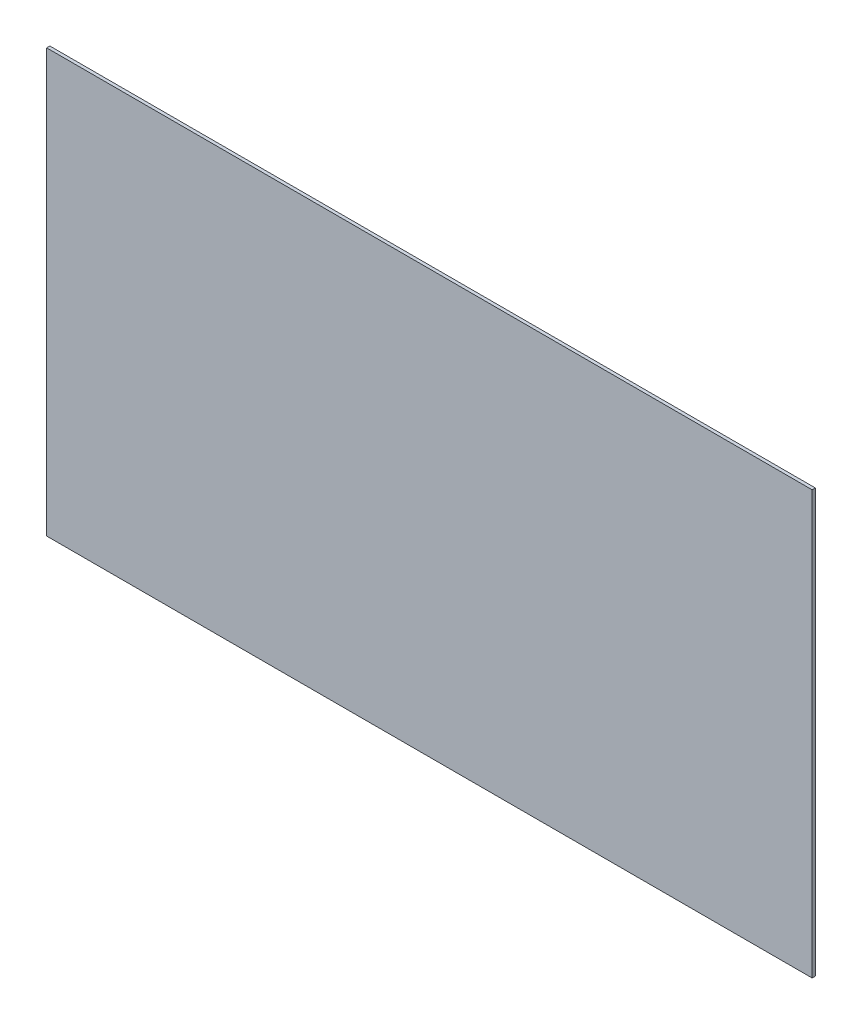
from build123d import *

# Parameters (mm, degrees)
SKETCH1_W           = 758.698
SKETCH1_H           = 419.1
BOSS_EXTRUDE1_DEPTH = 3.175


with BuildPart() as part:
    # Sketch1 → Boss-Extrude1 (new body)
    with BuildSketch(Plane.XY):
        with Locations((-406.4, 215.9)):
            Rectangle(SKETCH1_W, SKETCH1_H)
    extrude(amount=BOSS_EXTRUDE1_DEPTH)


solid = part.part
